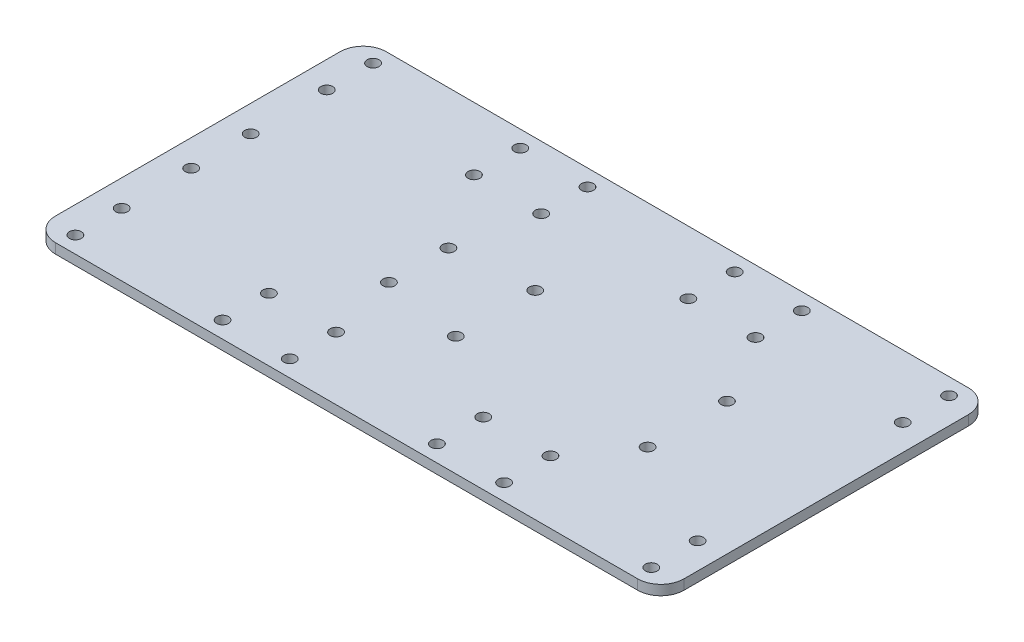
from build123d import *

# Parameters (mm, degrees)
SKETCH1_W            = 190
SKETCH1_H            = 100
BOSS_EXTRUDE1_DEPTH  = 3
M3_CLEARANCE_HOLE1_D = 3.6
FILLET1_R            = 7


with BuildPart() as part:
    # Sketch1 → Boss-Extrude1 (new body)
    with BuildSketch(Plane(origin=(0, 0, 0), x_dir=(1, 0, 0), z_dir=(0, 1, 0))):
        with Locations((95, 50)):
            Rectangle(SKETCH1_W, SKETCH1_H)
    extrude(amount=BOSS_EXTRUDE1_DEPTH)

    # M3 Clearance Hole1 (through all)
    with Locations(Plane(origin=(0, 3, 0), x_dir=(1, 0, 0), z_dir=(0, 1, 0))):
        with Locations((8, 95), (52.5, 95), (52.5, 81), (8, 81), (52.5, 19), (52.5, 5), (8, 19), (8, 5), (72.811, 95), (117.311, 95), (117.311, 81), (72.811, 81), (137.622, 95), (182.122, 95), (182.122, 81), (137.622, 81), (72.811, 19), (117.311, 19), (137.622, 19), (182.122, 19), (182.122, 5), (137.622, 5), (117.311, 5), (72.811, 5), (8, 58), (8, 40), (67.78, 58), (67.78, 40), (92, 60), (92, 36), (150, 36), (150, 60)):
            Hole(M3_CLEARANCE_HOLE1_D / 2)

    # Fillet1
    fillet1_edges = [part.edges().sort_by_distance(p)[0] for p in [
        (190, 1.5, -100),
        (190, 1.5, 0),
        (0, 1.5, 0),
        (0, 1.5, -100),
    ]]
    fillet(fillet1_edges, radius=FILLET1_R)


solid = part.part
